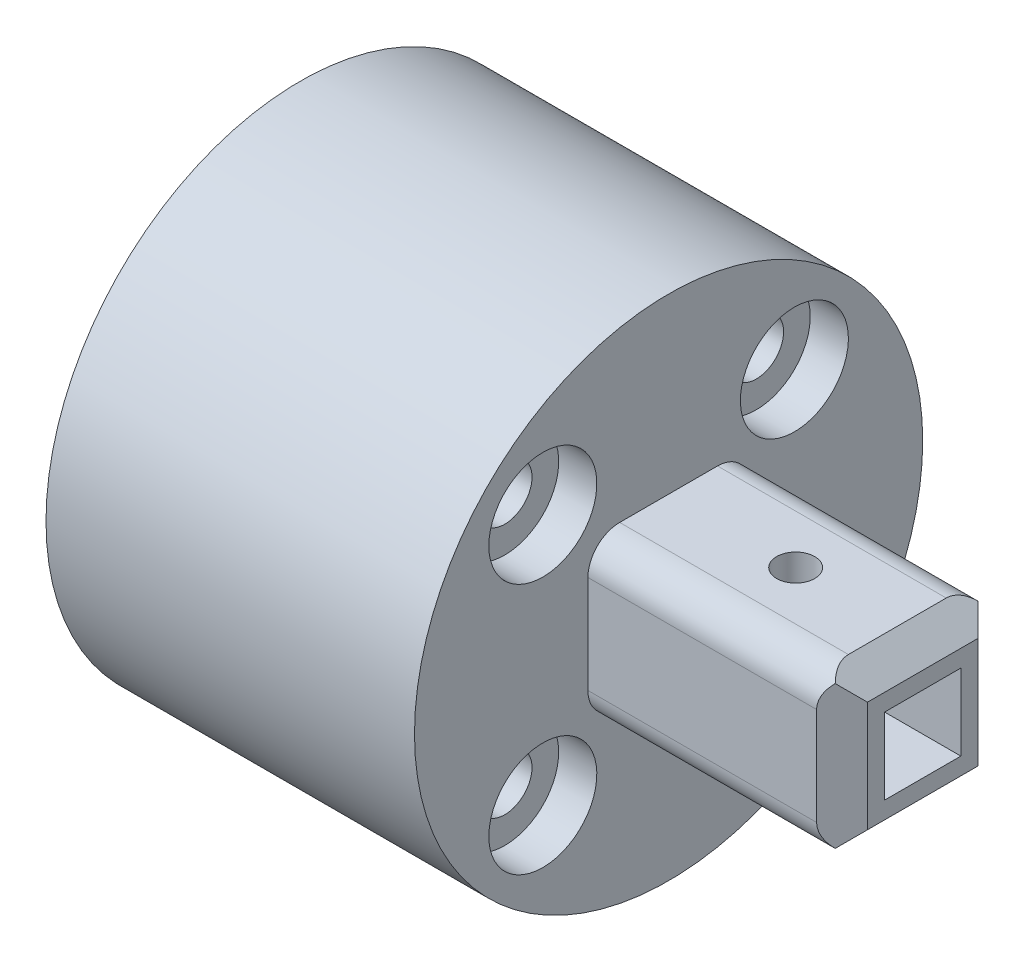
from build123d import *

# Parameters (mm, degrees)
SKETCH_1_R               = 20
EXTRUDE_1_DEPTH          = 10
SKETCH_2_W               = 15
SKETCH_2_H               = 30.5
CUT_EXTRUDE_1_DEPTH      = 4
SKETCH_3_R               = 8.75
CUT_EXTRUDE_2_DEPTH      = 4
EXTRUDE_START            = 19
SKETCH_4_R               = 20
SKETCH_4_W               = 18
SKETCH_4_H               = 32
EXTRUDE_2_DEPTH          = 19
FILLET_1_R               = 3
SKETCH_5_R               = 2.5
CUT_EXTRUDE_3_DEPTH      = 20
FILLET_2_R               = 3
SKETCH_6_R               = 2.15
CUT_EXTRUDE_4_DEPTH      = 43
FILLET_3_R               = 1
SKETCH_7_R               = 4.25
CUT_EXTRUDE_5_DEPTH      = 3
PATTERN_CIRCULAR_1_COUNT = 4
SKETCH_8_W               = 12.7
SKETCH_8_H               = 12.7
EXTRUDE_3_DEPTH          = 20
SKETCH_9_W               = 6
SKETCH_9_H               = 6
CUT_EXTRUDE_6_DEPTH      = 35
SKETCH_10_W              = 3
SKETCH_10_H              = 15
CUT_EXTRUDE_7_DEPTH      = 5
SKETCH_11_R              = 2.5
CUT_EXTRUDE_8_DEPTH      = 5
SKETCH_12_R              = 1.5
CUT_EXTRUDE_9_DEPTH      = 17
CHAMFER_1_SIZE           = 2
FILLET_4_R               = 3
FILLET_5_R               = 2.5


with BuildPart() as part:
    # 草图1 → 凸台-拉伸1 (new body)
    with BuildSketch(Plane(origin=(0, 0, 0), x_dir=(0, 0, -1), z_dir=(1, 0, 0))):
        Circle(SKETCH_1_R)
    extrude(amount=EXTRUDE_1_DEPTH)

    # 草图2 → 切除-拉伸1 (cut)
    with BuildSketch(Plane.ZY):
        Rectangle(SKETCH_2_W, SKETCH_2_H)
    extrude(amount=-CUT_EXTRUDE_1_DEPTH, mode=Mode.SUBTRACT)

    # 草图3 → 切除-拉伸2 (cut)
    with BuildSketch(Plane.ZY.offset(-4)):
        Circle(SKETCH_3_R)
    extrude(amount=CUT_EXTRUDE_2_DEPTH, mode=Mode.SUBTRACT)

    # 草图4 → 凸台-拉伸2 (add)
    with BuildSketch(Plane.ZY.offset(EXTRUDE_START)):
        Circle(SKETCH_4_R)
        Rectangle(SKETCH_4_W, SKETCH_4_H, mode=Mode.SUBTRACT)
    extrude(amount=-EXTRUDE_2_DEPTH)

    # 圆角1
    fillet_1_edges = [part.edges().sort_by_distance(p)[0] for p in [
        (-9.5, 16, 9),
        (-9.5, 16, -9),
        (-9.5, -16, -9),
        (-9.5, -16, 9),
    ]]
    fillet(fillet_1_edges, radius=FILLET_1_R)

    # 草图5 → 切除-拉伸3 (cut)
    with BuildSketch(Plane.ZY.offset(19)):
        with Locations((0, -16)):
            Circle(SKETCH_5_R)
        with Locations((0, 16)):
            Circle(SKETCH_5_R)
    extrude(amount=-CUT_EXTRUDE_3_DEPTH, mode=Mode.SUBTRACT)

    # 圆角2
    # the kernel refuses this fillet: 3 mm, written as the material it takes off along each edge
    with BuildSketch(Plane(origin=(-24.274430572, -16, 2.5), x_dir=(0, -0.9586814917396833, -0.2844816292764363), z_dir=(1, 0, 0))) as fillet_2_piece_1:
        with BuildLine():
            CenterArc((2.275853034, -2.876044475), FILLET_2_R, 106.527865575, 56.944268849)
            Line((-0.600191441, -2.022599587), (0, 0))
            ThreePointArc((0, 0), (0.711204073, -0.103296271), (1.422408146, 0))
        make_face()
    extrude(amount=24.274430572, mode=Mode.SUBTRACT)
    with BuildSketch(Plane(origin=(0, -16, -2.5), x_dir=(0, 0, -1), z_dir=(-1, 0, 0))) as fillet_2_piece_2:
        with BuildLine():
            CenterArc((2.109772229, 3), FILLET_2_R, 213.055731151, 56.944268849)
            ThreePointArc((-0.404648987, 1.363636364), (-0.103296271, 0.711204073), (0, 0))
            Line((0, 0), (2.109772229, 0))
        make_face()
    extrude(amount=24.274430572, mode=Mode.SUBTRACT)
    with BuildSketch(Plane(origin=(0, 16, -2.5), x_dir=(0, 0.9586814917396834, 0.2844816292764354), z_dir=(-1, 0, 0))) as fillet_2_piece_3:
        with BuildLine():
            CenterArc((2.275853034, 2.876044475), FILLET_2_R, 196.527865575, 56.944268849)
            Line((-0.600191441, 2.022599587), (0, 0))
            ThreePointArc((0, 0), (0.711204073, 0.103296271), (1.422408146, 0))
        make_face()
    extrude(amount=24.274430572, mode=Mode.SUBTRACT)
    with BuildSketch(Plane(origin=(-24.274430572, 16, 2.5), x_dir=(0, 0, 1), z_dir=(1, 0, 0))) as fillet_2_piece_4:
        with BuildLine():
            CenterArc((2.109772229, -3), FILLET_2_R, 90, 56.944268849)
            ThreePointArc((-0.404648987, -1.363636364), (-0.103296271, -0.711204073), (0, 0))
            Line((0, 0), (2.109772229, 0))
        make_face()
    extrude(amount=24.274430572, mode=Mode.SUBTRACT)

    # 草图6 → 切除-拉伸4 (cut)
    with BuildSketch(Plane(origin=(10, 0, 0), x_dir=(0, 0, -1), z_dir=(1, 0, 0))):
        with Locations((9.899494937, -9.899494937)):
            Circle(SKETCH_6_R)
        with Locations((-9.899494937, -9.899494937)):
            Circle(SKETCH_6_R)
        with Locations((-9.899494937, 9.899494937)):
            Circle(SKETCH_6_R)
        with Locations((9.899494937, 9.899494937)):
            Circle(SKETCH_6_R)
    extrude(amount=-CUT_EXTRUDE_4_DEPTH, mode=Mode.SUBTRACT)

    # 圆角3
    # the kernel refuses this fillet: 1 mm, written as the material it takes off along each edge
    with BuildSketch(Plane(origin=(-21.98900269, -7.946699797, 9), x_dir=(0, 0.1985408891964352, 0.9800926054802622), z_dir=(1, 0, 0)), Plane(origin=(-21.98900269, 7.946699797, -9), x_dir=(0, -0.19854088919647347, -0.9800926054802545), z_dir=(1, 0, 0))) as fillet_3_piece_1:
        with BuildLine():
            CenterArc((1.217468306, -0.973258884), FILLET_3_R, 103.280057781, 88.171589383)
            Line((0.237375701, -1.171799774), (0, 0))
            ThreePointArc((0, 0), (0.493878653, -0.057493399), (0.987757305, 0))
        make_face()
    extrude(amount=21.98900269, mode=Mode.SUBTRACT)
    with BuildSketch(Plane(origin=(-21.959087911, -11.852290077, 9), x_dir=(0, -0.999999983485678, -0.00018173784322620402), z_dir=(1, 0, 0)), Plane(origin=(-21.959087911, 11.852290077, -9), x_dir=(0, 0.9999999834856781, 0.00018173784322619477), z_dir=(1, 0, 0))) as fillet_3_piece_2:
        with BuildLine():
            CenterArc((1.195428513, -0.999930456), FILLET_3_R, 90.675724778, 87.490671362)
            Line((0.195940547, -0.967933494), (0.09599175, -0.964733798))
            ThreePointArc((0.09599175, -0.964733798), (0.056286672, -0.492404834), (-0.090835283, -0.041820466))
            Line((-0.090835283, -0.041820466), (1.8174e-05, 0.099999998))
            ThreePointArc((1.8174e-05, 0.099999998), (1.147728078, 0.099791416), (1.182455829, 0.099993046))
            Line((1.182455829, 0.099993046), (1.183635164, 0))
        make_face()
    extrude(amount=21.959087911, mode=Mode.SUBTRACT)
    with BuildSketch(Plane(origin=(-21.959087911, -11.852290077, -9), x_dir=(0, -0.19858553154825268, -0.98008356105982), z_dir=(1, 0, 0)), Plane(origin=(-21.959087911, 11.852290077, 9), x_dir=(0, 0.19858553154822475, 0.9800835610598256), z_dir=(1, 0, 0))) as fillet_3_piece_3:
        with BuildLine():
            CenterArc((1.217233349, -0.973269347), FILLET_3_R, 103.277447997, 87.490671362)
            Line((0.234841987, -1.160104066), (0.136602851, -1.178787538))
            ThreePointArc((0.136602851, -1.178787538), (0.129910229, -1.144710182), (-0.098008356, -0.019858553))
            Line((-0.098008356, -0.019858553), (0.022966667, 0.097326935))
            ThreePointArc((0.022966667, 0.097326935), (0.49378334, 0.042529095), (0.964600013, 0.097326935))
            Line((0.964600013, 0.097326935), (0.987566679, 0))
        make_face()
    extrude(amount=21.959087911, mode=Mode.SUBTRACT)
    with BuildSketch(Plane(origin=(-21.98900269, -7.946699797, -9), x_dir=(0, 1, 0), z_dir=(1, 0, 0)), Plane(origin=(-21.98900269, 7.946699797, 9), x_dir=(0, -1, 0), z_dir=(1, 0, 0))) as fillet_3_piece_4:
        with BuildLine():
            CenterArc((1.195601076, -1), FILLET_3_R, 90, 88.171589383)
            ThreePointArc((0.196110214, -0.968093631), (0.154403962, -0.472632025), (0, 0))
            Line((0, 0), (1.195601076, 0))
        make_face()
    extrude(amount=21.98900269, mode=Mode.SUBTRACT)

    # 草图7 → 切除-拉伸5 (cut)
    with BuildSketch(Plane(origin=(10, 0, 0), x_dir=(0, 0, -1), z_dir=(1, 0, 0))):
        with Locations((9.899494937, -9.899494937)):
            Circle(SKETCH_7_R)
    cut_extrude_5 = extrude(amount=-CUT_EXTRUDE_5_DEPTH, mode=Mode.SUBTRACT)

    # 阵列(圆周)1: 切除-拉伸5 ×4 about axis
    pattern_circular_1_axis = Axis((0, 0, 0), (1, 0, 0))
    for i in range(1, PATTERN_CIRCULAR_1_COUNT):
        add(cut_extrude_5.rotate(pattern_circular_1_axis, i * 360 / PATTERN_CIRCULAR_1_COUNT), mode=Mode.SUBTRACT)

    # 草图8 → 凸台-拉伸3 (add)
    with BuildSketch(Plane(origin=(10, 0, 0), x_dir=(0, 0, -1), z_dir=(1, 0, 0))):
        Rectangle(SKETCH_8_W, SKETCH_8_H)
    extrude(amount=EXTRUDE_3_DEPTH)

    # 草图9 → 切除-拉伸6 (cut)
    with BuildSketch(Plane(origin=(30, 0, 0), x_dir=(0, 0, -1), z_dir=(1, 0, 0))):
        Rectangle(SKETCH_9_W, SKETCH_9_H)
    extrude(amount=-CUT_EXTRUDE_6_DEPTH, mode=Mode.SUBTRACT)

    # 草图10 → 切除-拉伸7 (cut)
    with BuildSketch(Plane.ZY.offset(-1)):
        with Locations((0, 10.5)):
            Rectangle(SKETCH_10_W, SKETCH_10_H)
    extrude(amount=-CUT_EXTRUDE_7_DEPTH, mode=Mode.SUBTRACT)

    # 草图11 → 切除-拉伸8 (cut)
    with BuildSketch(Plane.ZY.offset(-1)):
        with Locations((0, 16)):
            Circle(SKETCH_11_R)
    extrude(amount=-CUT_EXTRUDE_8_DEPTH, mode=Mode.SUBTRACT)

    # 草图12 → 切除-拉伸9 (cut)
    with BuildSketch(Plane.XZ.offset(6.35)):
        with Locations(Location((20, 0, 0), (0, 0, 270))):
            Circle(SKETCH_12_R)
    extrude(amount=-CUT_EXTRUDE_9_DEPTH, mode=Mode.SUBTRACT)

    # 倒角1
    chamfer_1_edges = [part.edges().sort_by_distance(p)[0] for p in [
        (30, 0, 6.35),
        (30, -6.35, 0),
        (30, 0, -6.35),
        (30, 6.35, 0),
    ]]
    chamfer(chamfer_1_edges, length=CHAMFER_1_SIZE)

    # 圆角4
    fillet_4_edges = [part.edges().sort_by_distance(p)[0] for p in [
        (6, 3, 0),
    ]]
    fillet(fillet_4_edges, radius=FILLET_4_R)

    # 圆角5
    fillet_5_edges = [part.edges().sort_by_distance(p)[0] for p in [
        (19, -6.35, 6.35),
        (19, 6.35, 6.35),
        (19, 6.35, -6.35),
        (19, -6.35, -6.35),
    ]]
    fillet(fillet_5_edges, radius=FILLET_5_R)


solid = part.part
